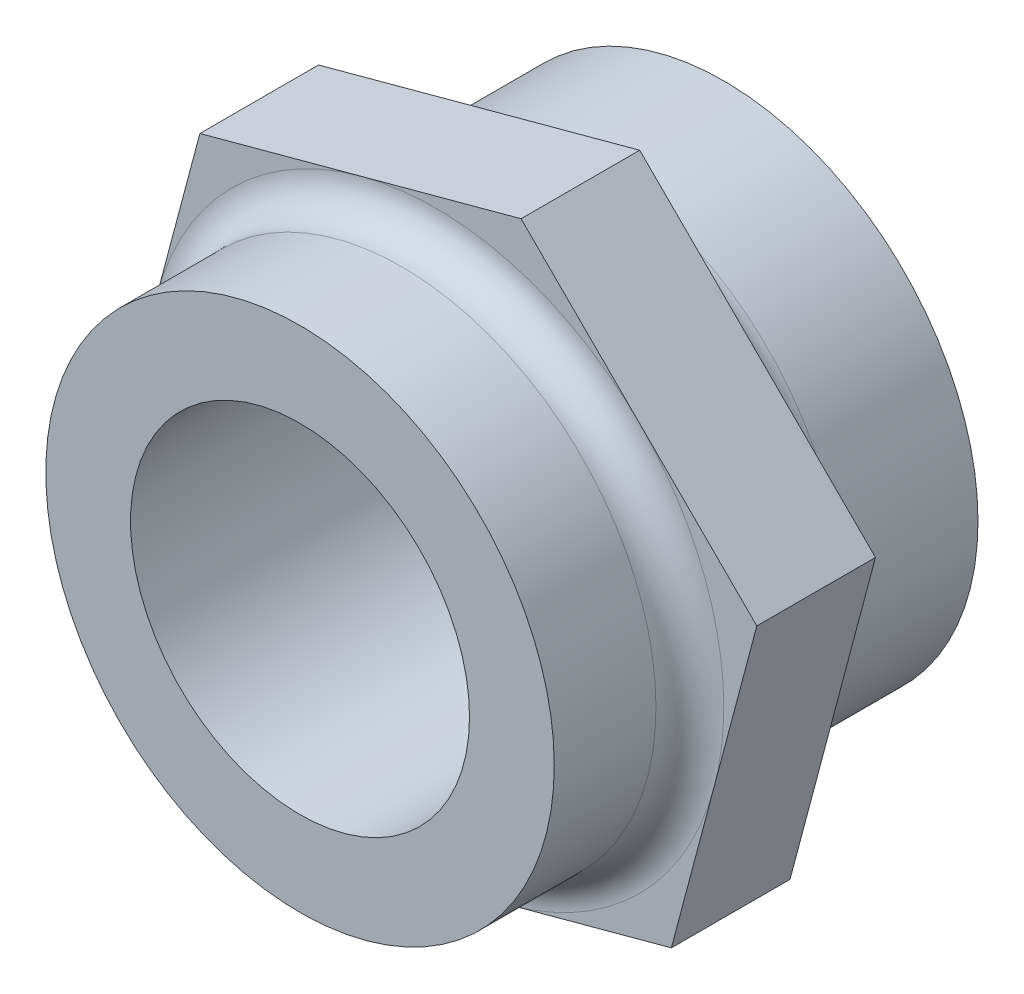
from build123d import *

# Parameters (mm, degrees)
SKETCH1_R           = 15
SKETCH1_R_2         = 10.5
BOSS_EXTRUDE1_DEPTH = 25
BOSS_EXTRUDE3_START = -15
SKETCH2_R           = 15
SKETCH2_R_2         = 10.25
BOSS_EXTRUDE3_DEPTH = 15
THREAD1_PITCH       = 2
THREAD1_FROM        = 5
THREAD1_TO          = 15
BOSS_EXTRUDE4_START = -15
SKETCH5_R           = 15
SKETCH5_R_2         = 10
BOSS_EXTRUDE4_DEPTH = 15
BOSS_EXTRUDE5_START = -15
SKETCH6_R           = 15
BOSS_EXTRUDE5_DEPTH = 15
CUT_EXTRUDE1_START  = -8
SKETCH7_R           = 15
CUT_EXTRUDE1_DEPTH  = 8
FILLET1_R           = 2


with BuildPart() as part:
    # Sketch1 → Boss-Extrude1 (new body)
    with BuildSketch(Plane.XY):
        Circle(SKETCH1_R)
        Circle(SKETCH1_R_2, mode=Mode.SUBTRACT)
    extrude(amount=BOSS_EXTRUDE1_DEPTH)

    # Sketch2 → Boss-Extrude3 (add)
    with BuildSketch(Plane.XY.offset(25).offset(BOSS_EXTRUDE3_START)):
        Circle(SKETCH2_R)
        Circle(SKETCH2_R_2, mode=Mode.SUBTRACT)
    extrude(amount=BOSS_EXTRUDE3_DEPTH)

    # Thread1: arcs per turn and ends read off the stored shape
    # Thread1: the profile of Thread Profile1 profile screwed along a right-hand helix through 10 turns, 10 arcs to a turn; built about Z, then put on its axis
    thread1_z = Axis((0, 0, 0), (0, 0, 1))
    thread1_corners = [(10.5003, 0, -0.000173205), (10.5003, 0, 1.7501732), (9.41746825, 0, 1.124999997), (9.41746825, 0, 0.624999997)]
    with BuildLine(mode=Mode.PRIVATE) as thread1_profile:
        Line(thread1_corners[0], thread1_corners[1])
        Line(thread1_corners[1], thread1_corners[2])
        Line(thread1_corners[2], thread1_corners[3])
        Line(thread1_corners[3], thread1_corners[0])
    thread1_cap = Face(thread1_profile.wire())
    thread1_turn_angles = [0, 18, 36, 54, 72, 90, 108, 126, 144, 162, 180, 198, 216, 234, 252, 270, 288, 306, 324, 342, 360]
    thread1_turn_weights = [1, 0.9510565162951535, 1, 0.9510565162951535, 1, 0.9510565162951535, 1, 0.9510565162951535, 1, 0.9510565162951535, 1, 0.9510565162951535, 1, 0.9510565162951535, 1, 0.9510565162951535, 1, 0.9510565162951535, 1, 0.9510565162951535, 1]
    thread1_turn_rails = [Edge.make_bspline([Vector(p[0], p[1], 0).rotate(thread1_z, thread1_turn_angles[k]) / thread1_turn_weights[k] + Vector(0, 0, p[2] + THREAD1_PITCH * thread1_turn_angles[k] / 360) for k in range(21)], [0, 0, 0, 1, 1, 2, 2, 3, 3, 4, 4, 5, 5, 6, 6, 7, 7, 8, 8, 9, 9, 10, 10, 10], 2, thread1_turn_weights) for p in thread1_corners]
    thread1_turn_sides = [Face.make_surface_from_curves(thread1_turn_rails[p[0]], thread1_turn_rails[p[1]]) for p in [(0, 1), (1, 2), (2, 3), (3, 0)]]
    thread1 = Plane(origin=(0, 0, -5), x_dir=(1, 0, 0), z_dir=(0, 0, 1)) * split(split(Solid(Shell([*[p.moved(Location((0, 0, THREAD1_PITCH * i))) for i in range(10) for p in thread1_turn_sides], thread1_cap, thread1_cap.rotate(thread1_z, 3600).moved(Location((0, 0, THREAD1_PITCH * 3600 / 360)))])), bisect_by=Plane.XY.offset(THREAD1_FROM), keep=Keep.TOP, mode=Mode.PRIVATE), bisect_by=Plane.XY.offset(THREAD1_TO), keep=Keep.BOTTOM, mode=Mode.PRIVATE)
    add(thread1)

    # Sketch5 → Boss-Extrude4 (add)
    with BuildSketch(Plane.XY.offset(25).offset(BOSS_EXTRUDE4_START)):
        Circle(SKETCH5_R)
        Circle(SKETCH5_R_2, mode=Mode.SUBTRACT)
    extrude(amount=BOSS_EXTRUDE4_DEPTH)

    # Sketch6 → Boss-Extrude5 (add)
    with BuildSketch(Plane.XY.offset(25).offset(BOSS_EXTRUDE5_START)):
        Polygon((-5.041605861, -18.971440211), (13.908946239, -13.851878857), (18.950552099, 5.119561354), (5.041605861, 18.971440211), (-13.908946239, 13.851878857), (-18.950552099, -5.119561354), align=None)
        Circle(SKETCH6_R, mode=Mode.SUBTRACT)
    extrude(amount=BOSS_EXTRUDE5_DEPTH)

    # Sketch7 → Cut-Extrude1 (cut)
    with BuildSketch(Plane.XY.offset(25).offset(CUT_EXTRUDE1_START)):
        Polygon((-18.950552099, -5.119561354), (-5.041605861, -18.971440211), (13.908946239, -13.851878857), (18.950552099, 5.119561354), (5.041605861, 18.971440211), (-13.908946239, 13.851878857), align=None)
        Circle(SKETCH7_R, mode=Mode.SUBTRACT)
    extrude(amount=CUT_EXTRUDE1_DEPTH, mode=Mode.SUBTRACT)

    # Fillet1
    fillet1_edges = [part.edges().sort_by_distance(p)[0] for p in [
        (-15, 0, 10),
        (-15, 0, 17),
    ]]
    fillet(fillet1_edges, radius=FILLET1_R - 0.0001)  # a hair under: the kernel refuses the full size


solid = part.part
